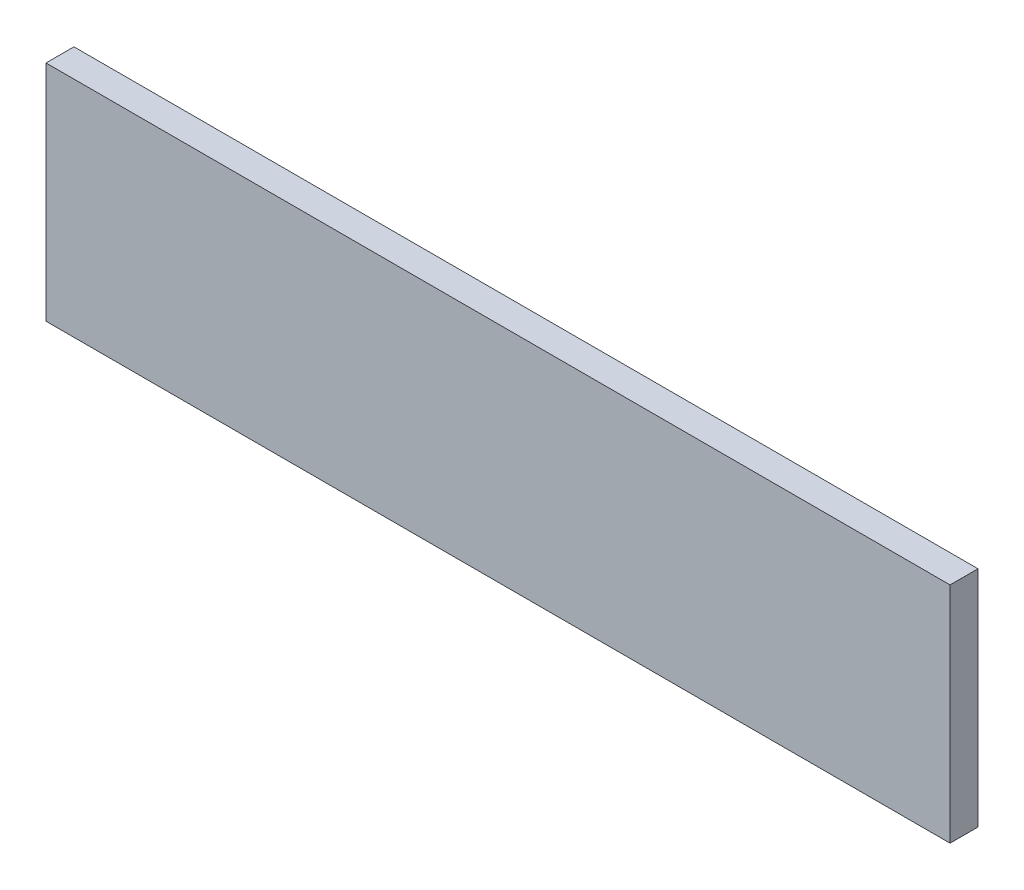
from build123d import *

# Parameters (mm, degrees)
SKETCH1_W           = 97
SKETCH1_H           = 24
BOSS_EXTRUDE1_DEPTH = 3


with BuildPart() as part:
    # Sketch1 → Boss-Extrude1 (new body)
    with BuildSketch(Plane.XY):
        Rectangle(SKETCH1_W, SKETCH1_H)
    extrude(amount=BOSS_EXTRUDE1_DEPTH)


solid = part.part
